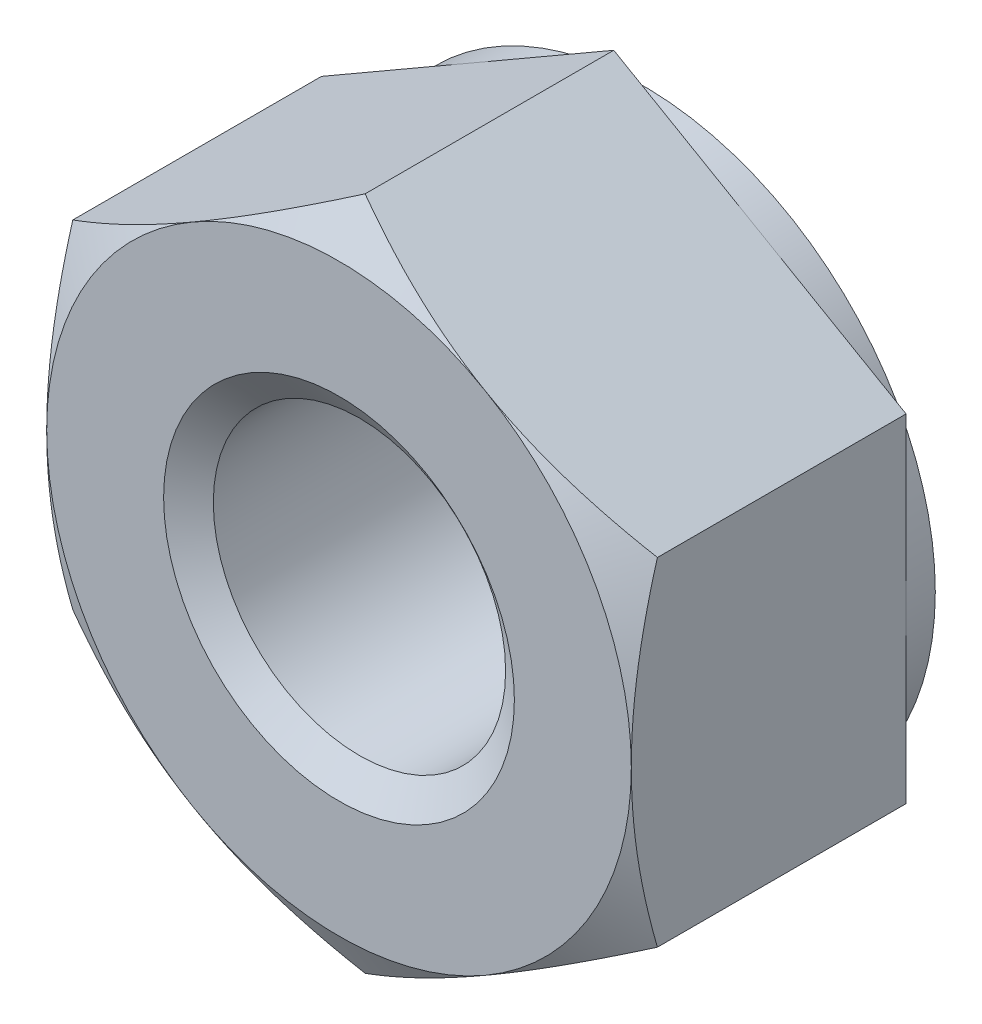
from build123d import *

# Parameters (mm, degrees)
BASENUT_START = -5.2
BASENUTSKE_R  = 2.5
BASENUT_DEPTH = 5.2
SKETCH4_W     = 0.5
SKETCH4_H     = 10.773502692


# Read off the part's stored shape, not the designer's step: ThreadSchematic
with BuildPart() as part:
    # BaseNutSke → BaseNut (new body)
    with BuildSketch(Plane.XY.offset(BASENUT_START)):
        Polygon((5, 2.886751346), (5, -2.886751346), (0, -5.773502692), (-5, -2.886751346), (-5, 2.886751346), (0, 5.773502692), align=None)
        Circle(BASENUTSKE_R, mode=Mode.SUBTRACT)
    extrude(amount=BASENUT_DEPTH)

    # Sketch5 (on Front Plane) → EndChamfer (revolve, cut)
    with BuildSketch(Plane.XY):
        Polygon((5.1746, 3), (4.789485854, 2.45), (5.2254, 2.45), (5.2254, 3), align=None)
    revolve(axis=Axis((5.2254, 2.45, 0), (-1, 0, 0)), mode=Mode.SUBTRACT)

    # Sketch4 → Bearing-Face (revolve, cut)
    with BuildSketch(Plane(origin=(0, 0, 0), x_dir=(0, 0, -1), z_dir=(1, 0, 0)), mode=Mode.PRIVATE) as bearing_face_sk:
        with Locations((4.95, 10.386751346)):
            Rectangle(SKETCH4_W, SKETCH4_H)
        Polygon((0, 5), (-10, 5), (-10, 15.773502692), (0.446581987, 15.773502692), (0.446581987, 5.773502692), align=None)
    revolve(bearing_face_sk.sketch.rotate(Axis((0, 0, 0), (0, 0, -1)), 90), axis=Axis((0, 0, 0), (0, 0, -1)), mode=Mode.SUBTRACT)

    # ThreadSchematic outline → ThreadSchematic (revolve, cut)
    with BuildSketch(Plane.XZ):
        Polygon((2.5, 0), (2.5, -0.350103769), (3, 0), align=None)
        Polygon((3, -5.1746), (2.5, -4.824496231), (2.5, -5.2), (3, -5.2), align=None)
    revolve(axis=Axis((0, 0, 0), (0, 0, 1)), mode=Mode.SUBTRACT)


solid = part.part
